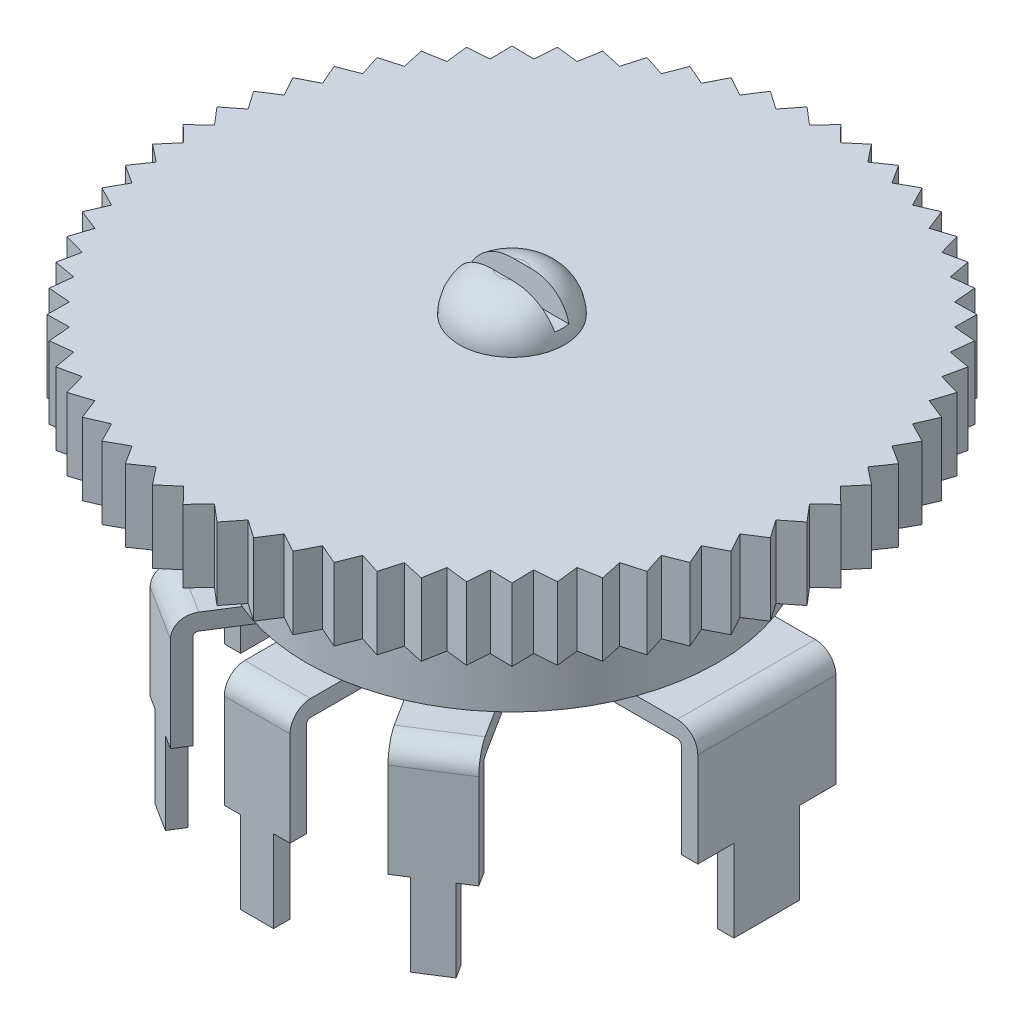
from build123d import *

# Parameters (mm, degrees)
SKETCH1_W                = 0.5
SKETCH1_H                = 4.2
BOSS_EXTRUDE1_DEPTH      = 3.5
SKETCH1_H_2              = 4
BOSS_EXTRUDE1_2_DEPTH    = 3.5
SKETCH1_W_2              = 2
SKETCH1_H_3              = 0.5
BOSS_EXTRUDE1_3_DEPTH    = 3.5
BOSS_EXTRUDE1_4_DEPTH    = 3.5
BOSS_EXTRUDE1_5_DEPTH    = 3.5
SKETCH2_W                = 0.5
SKETCH2_H                = 2
SKETCH2_W_2              = 1
SKETCH2_H_2              = 0.5
BOSS_EXTRUDE2_DEPTH      = 2.5
BOSS_EXTRUDE3_DEPTH      = 0.5
SKETCH5_R                = 6.25
BOSS_EXTRUDE4_DEPTH      = 3.7
FILLET6_R                = 0.625
FILLET8_R                = 0.125
BOSS_EXTRUDE5_DEPTH      = 0.9
BOSS_EXTRUDE6_DEPTH      = 1.45
BOSS_EXTRUDE6_DEPTH_BACK = 0.75
SKETCH9_R                = 1.6
BOSS_EXTRUDE7_DEPTH      = 1.2
FILLET9_R                = 1.2
SKETCH10_W               = 4.34437475
SKETCH10_H               = 0.6
CUT_EXTRUDE1_DEPTH       = 0.8
CUT_EXTRUDE1_DRAFT       = -6
SKETCH11_R               = 0.675
SKETCH11_R_2             = 0.425
SKETCH11_R_3             = 0.875
SKETCH11_R_4             = 0.625
BOSS_EXTRUDE8_DEPTH      = 0.25
FILLET10_R               = 0.125
CUT_EXTRUDE3_START       = -0.25
SKETCH12_R               = 0.625
SKETCH12_R_2             = 0.425
CUT_EXTRUDE3_DEPTH       = 0.25


with BuildPart() as part:
    # Sketch1 → Boss-Extrude1 (new body)
    with BuildSketch(Plane(origin=(0, 0, 0), x_dir=(1, 0, 0), z_dir=(0, 1, 0))):
        with Locations((7.5, 0)):
            Rectangle(SKETCH1_W, SKETCH1_H)
    extrude(amount=BOSS_EXTRUDE1_DEPTH)



with BuildPart() as body_2:
    # Sketch1 → Boss-Extrude1 2 (new body)
    with BuildSketch(Plane(origin=(0, 0, 0), x_dir=(1, 0, 0), z_dir=(0, 1, 0))):
        with Locations((-7.5, 0)):
            Rectangle(SKETCH1_W, SKETCH1_H_2)
    extrude(amount=BOSS_EXTRUDE1_2_DEPTH)


with BuildPart() as body_3:
    # Sketch1 → Boss-Extrude1 3 (new body)
    with BuildSketch(Plane(origin=(0, 0, 0), x_dir=(1, 0, 0), z_dir=(0, 1, 0))):
        with Locations((0, -7.5)):
            Rectangle(SKETCH1_W_2, SKETCH1_H_3)
    extrude(amount=BOSS_EXTRUDE1_3_DEPTH)


with BuildPart() as body_4:
    # Sketch1 → Boss-Extrude1 4 (new body)
    with BuildSketch(Plane(origin=(0, 0, 0), x_dir=(1, 0, 0), z_dir=(0, 1, 0))):
        Polygon((-4.996985587, -6.007714628), (-3.308329736, -7.079368218), (-3.040416338, -6.657204255), (-4.729072189, -5.585550665), align=None)
    extrude(amount=BOSS_EXTRUDE1_4_DEPTH)


with BuildPart() as body_5:
    # Sketch1 → Boss-Extrude1 5 (new body)
    with BuildSketch(Plane(origin=(0, 0, 0), x_dir=(1, 0, 0), z_dir=(0, 1, 0))):
        Polygon((3.308329736, -7.079368218), (4.996985587, -6.007714628), (4.729072189, -5.585550665), (3.040416338, -6.657204255), align=None)
    extrude(amount=BOSS_EXTRUDE1_5_DEPTH)


with BuildPart() as part_1:
    add(part.part)

    add(body_2.part)  # Boss-Extrude2 merges body 2

    add(body_3.part)  # Boss-Extrude2 merges body 3

    add(body_4.part)  # Boss-Extrude2 merges body 4

    add(body_5.part)  # Boss-Extrude2 merges body 5
    # Sketch2 → Boss-Extrude2 (add)
    with BuildSketch(Plane.XZ):
        with Locations((7.5, 0)):
            Rectangle(SKETCH2_W, SKETCH2_H)
        with Locations((-7.5, 0)):
            Rectangle(SKETCH2_W, SKETCH2_H)
        with Locations((0, 7.5)):
            Rectangle(SKETCH2_W_2, SKETCH2_H_2)
        Polygon((-4.574821624, 6.275628025), (-3.730493698, 6.81145482), (-3.462580301, 6.389290857), (-4.306908226, 5.853464062), align=None)
        Polygon((3.462580301, 6.389290857), (4.306908226, 5.853464062), (4.574821624, 6.275628025), (3.730493698, 6.81145482), align=None)
    extrude(amount=BOSS_EXTRUDE2_DEPTH)

    # Sketch3 → Boss-Extrude3 (add)
    with BuildSketch(Plane(origin=(0, 3.5, 0), x_dir=(1, 0, 0), z_dir=(0, 1, 0))):
        with BuildLine():
            Line((-1, -7.75), (1, -7.75))
            Line((1, -7.75), (1, -4.4))
            ThreePointArc((1, -4.4), (0, -3.4), (-1, -4.4))
            Line((-1, -4.4), (-1, -7.75))
        make_face()
        with BuildLine():
            Line((3.308329736, -7.079368218), (4.996985587, -6.007714628))
            Line((4.996985587, -6.007714628), (3.201965823, -3.179216077))
            ThreePointArc((3.201965823, -3.179216077), (1.821811103, -2.870714947), (1.513309972, -4.250869667))
            Line((1.513309972, -4.250869667), (3.308329736, -7.079368218))
        make_face()
        with BuildLine():
            Line((-7.75, 2), (-7.75, -2))
            Line((-7.75, -2), (-4.125, -2))
            ThreePointArc((-4.125, -2), (-3.417893219, -1.707106781), (-3.125, -1))
            Line((-3.125, -1), (-3.125, 1))
            ThreePointArc((-3.125, 1), (-3.417893219, 1.707106781), (-4.125, 2))
            Line((-4.125, 2), (-7.75, 2))
        make_face()
        with BuildLine():
            Line((-4.996985587, -6.007714628), (-3.308329736, -7.079368218))
            Line((-3.308329736, -7.079368218), (-1.513309972, -4.250869667))
            ThreePointArc((-1.513309972, -4.250869667), (-1.821811103, -2.870714947), (-3.201965823, -3.179216077))
            Line((-3.201965823, -3.179216077), (-4.996985587, -6.007714628))
        make_face()
        with BuildLine():
            Line((7.75, -2.1), (7.75, 2.1))
            Line((7.75, 2.1), (4.125, 2.1))
            ThreePointArc((4.125, 2.1), (3.417893219, 1.807106781), (3.125, 1.1))
            Line((3.125, 1.1), (3.125, -1.1))
            ThreePointArc((3.125, -1.1), (3.417893219, -1.807106781), (4.125, -2.1))
            Line((4.125, -2.1), (7.75, -2.1))
        make_face()
    extrude(amount=-BOSS_EXTRUDE3_DEPTH)

    # Sketch5 → Boss-Extrude4 (add)
    with BuildSketch(Plane(origin=(0, 3.5, 0), x_dir=(1, 0, 0), z_dir=(0, 1, 0))):
        with Locations(Location((0, 0, 0), (0, 0, 19.633358898))):
            Circle(SKETCH5_R)
    extrude(amount=BOSS_EXTRUDE4_DEPTH)

    # Fillet6
    fillet6_edges = [part_1.edges().sort_by_distance(p)[0] for p in [
        (7.75, 3.5, 0),
        (-4.152657661, 3.5, 6.543541423),
        (4.152657661, 3.5, 6.543541423),
        (-7.75, 3.5, 0),
        (0, 3.5, 7.75),
    ]]
    fillet(fillet6_edges, radius=FILLET6_R)

    # Fillet8
    fillet8_edges = [part_1.edges().sort_by_distance(p)[0] for p in [
        (-3.884744264, 3, 6.12137746),
        (3.884744264, 3, 6.12137746),
        (7.25, 3, 0),
        (-7.25, 3, 0),
        (0, 3, 7.25),
    ]]
    fillet(fillet8_edges, radius=FILLET8_R)

    # Sketch6 → Boss-Extrude5 (add)
    with BuildSketch(Plane(origin=(0, 7.2, 0), x_dir=(1, 0, 0), z_dir=(0, 1, 0))):
        with BuildLine():
            Line((0.011152389, -1.749964464), (-1.713359077, 0.356231207))
            ThreePointArc((-1.713359077, 0.356231207), (-1.108651454, 1.354028047), (-0.011152389, 1.749964464))
            Line((-0.011152389, 1.749964464), (1.713359077, -0.356231207))
            ThreePointArc((1.713359077, -0.356231207), (1.108651454, -1.354028047), (0.011152389, -1.749964464))
        make_face()
    extrude(amount=BOSS_EXTRUDE5_DEPTH)

    # Sketch8 → Boss-Extrude6 (add, two sides: drawn at the far end of the back side and taken through both)
    with BuildSketch(Plane(origin=(0, 8.1, 0), x_dir=(1, 0, 0), z_dir=(0, 1, 0)).offset(-BOSS_EXTRUDE6_DEPTH_BACK)):
        Polygon((0.980171403, 9.951847267), (1.397956964, 9.424260337), (1.95090322, 9.807852804), (2.314964467, 9.241856204), (2.902846773, 9.569403357), (3.209677597, 8.970447943), (3.826834324, 9.238795325), (4.073479777, 8.612649365), (4.713967368, 8.819212643), (4.89805212, 8.171906265), (5.55570233, 8.314696123), (5.675453543, 7.652463241), (6.343932842, 7.730104534), (6.398197246, 7.059322812), (7.071067812, 7.071067812), (7.059322812, 6.398197246), (7.730104534, 6.343932842), (7.652463241, 5.675453543), (8.314696123, 5.55570233), (8.171906265, 4.89805212), (8.819212643, 4.713967368), (8.612649365, 4.073479777), (9.238795325, 3.826834324), (8.970447943, 3.209677597), (9.569403357, 2.902846773), (9.241856204, 2.314964467), (9.807852804, 1.95090322), (9.424260337, 1.397956964), (9.951847267, 0.980171403), (9.515903691, 0.467486371), (10, 0), (9.515903691, -0.467486371), (9.951847267, -0.980171403), (9.424260337, -1.397956964), (9.807852804, -1.95090322), (9.241856204, -2.314964467), (9.569403357, -2.902846773), (8.970447943, -3.209677597), (9.238795325, -3.826834324), (8.612649365, -4.073479777), (8.819212643, -4.713967368), (8.171906265, -4.89805212), (8.314696123, -5.55570233), (7.652463241, -5.675453543), (7.730104534, -6.343932842), (7.059322812, -6.398197246), (7.071067812, -7.071067812), (6.398197246, -7.059322812), (6.343932842, -7.730104534), (5.675453543, -7.652463241), (5.55570233, -8.314696123), (4.89805212, -8.171906265), (4.713967368, -8.819212643), (4.073479777, -8.612649365), (3.826834324, -9.238795325), (3.209677597, -8.970447943), (2.902846773, -9.569403357), (2.314964467, -9.241856204), (1.95090322, -9.807852804), (1.397956964, -9.424260337), (0.980171403, -9.951847267), (0.467486371, -9.515903691), (0, -10), (-0.467486371, -9.515903691), (-0.980171403, -9.951847267), (-1.397956964, -9.424260337), (-1.95090322, -9.807852804), (-2.314964467, -9.241856204), (-2.902846773, -9.569403357), (-3.209677597, -8.970447943), (-3.826834324, -9.238795325), (-4.073479777, -8.612649365), (-4.713967368, -8.819212643), (-4.89805212, -8.171906265), (-5.55570233, -8.314696123), (-5.675453543, -7.652463241), (-6.343932842, -7.730104534), (-6.398197246, -7.059322812), (-7.071067812, -7.071067812), (-7.059322812, -6.398197246), (-7.730104534, -6.343932842), (-7.652463241, -5.675453543), (-8.314696123, -5.55570233), (-8.171906265, -4.89805212), (-8.819212643, -4.713967368), (-8.612649365, -4.073479777), (-9.238795325, -3.826834324), (-8.970447943, -3.209677597), (-9.569403357, -2.902846773), (-9.241856204, -2.314964467), (-9.807852804, -1.95090322), (-9.424260337, -1.397956964), (-9.951847267, -0.980171403), (-9.515903691, -0.467486371), (-10, 0), (-9.515903691, 0.467486371), (-9.951847267, 0.980171403), (-9.424260337, 1.397956964), (-9.807852804, 1.95090322), (-9.241856204, 2.314964467), (-9.569403357, 2.902846773), (-8.970447943, 3.209677597), (-9.238795325, 3.826834324), (-8.612649365, 4.073479777), (-8.819212643, 4.713967368), (-8.171906265, 4.89805212), (-8.314696123, 5.55570233), (-7.652463241, 5.675453543), (-7.730104534, 6.343932842), (-7.059322812, 6.398197246), (-7.071067812, 7.071067812), (-6.398197246, 7.059322812), (-6.343932842, 7.730104534), (-5.675453543, 7.652463241), (-5.55570233, 8.314696123), (-4.89805212, 8.171906265), (-4.713967368, 8.819212643), (-4.073479777, 8.612649365), (-3.826834324, 9.238795325), (-3.209677597, 8.970447943), (-2.902846773, 9.569403357), (-2.314964467, 9.241856204), (-1.95090322, 9.807852804), (-1.397956964, 9.424260337), (-0.980171403, 9.951847267), (-0.467486371, 9.515903691), (0, 10), (0.467486371, 9.515903691), align=None)
    extrude(amount=BOSS_EXTRUDE6_DEPTH + BOSS_EXTRUDE6_DEPTH_BACK)

    # Sketch9 → Boss-Extrude7 (add)
    with BuildSketch(Plane(origin=(0, 9.55, 0), x_dir=(1, 0, 0), z_dir=(0, 1, 0))):
        with Locations(Location((0, 0, 0), (0, 0, 90))):
            Circle(SKETCH9_R)
    extrude(amount=BOSS_EXTRUDE7_DEPTH)

    # Fillet9
    fillet9_edges = [part_1.edges().sort_by_distance(p)[0] for p in [
        (0, 10.75, 1.6),
    ]]
    fillet(fillet9_edges, radius=FILLET9_R - 0.0001)  # a hair under: the kernel refuses the full size


with BuildPart() as cut_extrude1_tool:
    # Sketch10 → Cut-Extrude1 (with draft: the straight prism first)
    with BuildSketch(Plane(origin=(0, 10.75, 0), x_dir=(1, 0, 0), z_dir=(0, 1, 0))):
        Rectangle(SKETCH10_W, SKETCH10_H)
    extrude(amount=-CUT_EXTRUDE1_DEPTH)
    # Cut-Extrude1: the draft: its side faces are tilted about the plane it starts from
    cut_extrude1_sides = [cut_extrude1_tool.faces().sort_by_distance(p)[0] for p in [
        (0, 10.35, 0.3),
        (2.172187375, 10.35, 0),
        (0, 10.35, -0.3),
        (-2.172187375, 10.35, 0),
    ]]
    draft(cut_extrude1_sides, Plane(origin=(0, 10.75, 0), x_dir=(1, 0, 0), z_dir=(0, 1, 0)), CUT_EXTRUDE1_DRAFT)


with BuildPart() as part_2:
    add(part_1.part)

    # Cut-Extrude1: cut by cut_extrude1_tool
    add(cut_extrude1_tool.part, mode=Mode.SUBTRACT)

    # Sketch11 → Boss-Extrude8 (add)
    # profile 1 of 5: a face of its own
    with BuildSketch(Plane.XZ.offset(-3)):
        with Locations(Location((-2.357637898, 3.715042872, 0), (0, 0, 90))):
            Circle(SKETCH11_R)
        with Locations(Location((-2.357637898, 3.715042872, 0), (0, 0, 270))):
            Circle(SKETCH11_R_2, mode=Mode.SUBTRACT)
    # profile 2 of 5: a face of its own
    with BuildSketch(Plane.XZ.offset(-3)):
        with Locations(Location((0, 4.4, 0), (0, 0, 90))):
            Circle(SKETCH11_R)
        with Locations(Location((0, 4.4, 0), (0, 0, 270))):
            Circle(SKETCH11_R_2, mode=Mode.SUBTRACT)
    # profile 3 of 5: a face of its own
    with BuildSketch(Plane.XZ.offset(-3)):
        with Locations(Location((2.357637898, 3.715042872, 0), (0, 0, 90))):
            Circle(SKETCH11_R)
        with Locations(Location((2.357637898, 3.715042872, 0), (0, 0, 270))):
            Circle(SKETCH11_R_2, mode=Mode.SUBTRACT)
    # profile 4 of 5: a face of its own
    with BuildSketch(Plane.XZ.offset(-3)):
        with Locations(Location((4.75, 0, 0), (0, 0, 90))):
            Circle(SKETCH11_R_3)
        with Locations(Location((4.75, 0, 0), (0, 0, 270))):
            Circle(SKETCH11_R_4, mode=Mode.SUBTRACT)
    # profile 5 of 5: a face of its own
    with BuildSketch(Plane.XZ.offset(-3)):
        with Locations(Location((-4.75, 0, 0), (0, 0, 270))):
            Circle(SKETCH11_R_3)
        with Locations(Location((-4.75, 0, 0), (0, 0, 270))):
            Circle(SKETCH11_R_4, mode=Mode.SUBTRACT)
    extrude(amount=BOSS_EXTRUDE8_DEPTH)

    # Fillet10
    fillet10_edges = [part_2.edges().sort_by_distance(p)[0] for p in [
        (-2.357637898, 2.75, 3.040042872),
        (-2.357637898, 2.75, 4.140042872),
        (0, 2.75, 3.725),
        (0, 2.75, 4.825),
        (2.357637898, 2.75, 3.040042872),
        (2.357637898, 2.75, 4.140042872),
        (4.75, 2.75, -0.875),
        (4.75, 2.75, 0.625),
        (-4.75, 2.75, 0.875),
        (-4.75, 2.75, 0.625),
    ]]
    fillet(fillet10_edges, radius=FILLET10_R - 0.0001)  # a hair under: the kernel refuses the full size

    # Sketch12 → Cut-Extrude3 (cut)
    with BuildSketch(Plane.XZ.offset(-3).offset(CUT_EXTRUDE3_START)):
        with Locations(Location((-4.75, 0, 0), (0, 0, 270))):
            Circle(SKETCH12_R)
        with Locations(Location((-2.357637898, 3.715042872, 0), (0, 0, 270))):
            Circle(SKETCH12_R_2)
        with Locations(Location((0, 4.4, 0), (0, 0, 270))):
            Circle(SKETCH12_R_2)
        with Locations(Location((2.357637898, 3.715042872, 0), (0, 0, 270))):
            Circle(SKETCH12_R_2)
        with Locations(Location((4.75, 0, 0), (0, 0, 270))):
            Circle(SKETCH12_R)
    extrude(amount=CUT_EXTRUDE3_DEPTH, mode=Mode.SUBTRACT)


solid = part_2.part
